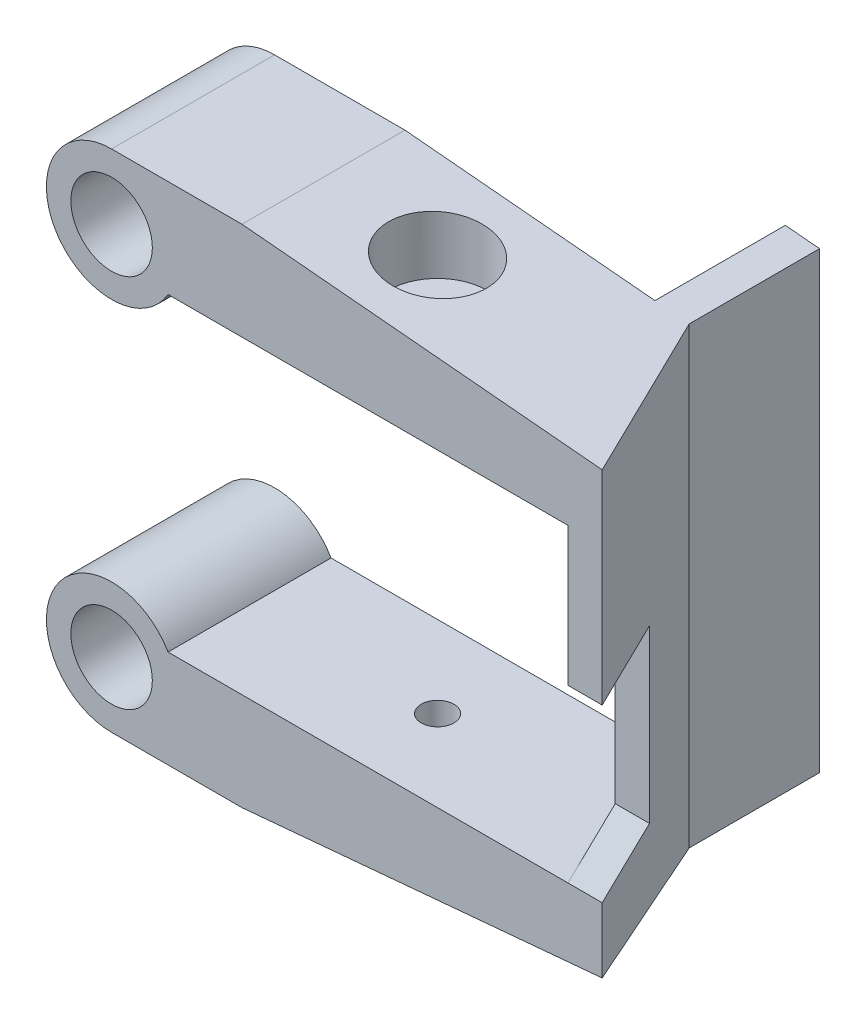
from build123d import *

# Parameters (mm, degrees)
CROQUIS1_R              = 2.5
SALIENTE_EXTRUIR1_DEPTH = 10
CROQUIS2_R              = 1
CORTAR_EXTRUIR1_DEPTH   = 4
CROQUIS3_R              = 3
CORTAR_EXTRUIR2_DEPTH   = 2
SALIENTE_EXTRUIR2_DEPTH = 13.5
SALIENTE_EXTRUIR3_START = 2
CROQUIS6_R              = 3
SALIENTE_EXTRUIR3_DEPTH = 2
CORTAR_EXTRUIR3_DEPTH   = 10
SALIENTE_EXTRUIR4_DEPTH = 8
CORTAR_EXTRUIR4_START   = 25.46614296
CORTAR_EXTRUIR4_DEPTH   = 4.63385704
CORTAR_EXTRUIR5_DEPTH   = 1


# Read off the part's stored shape, not the designer's step: Cortar-Extruir4
with BuildPart() as part:
    # Croquis1 → Saliente-Extruir1 (new body)
    with BuildSketch(Plane.XY):
        with BuildLine():
            Line((3.464101615, 3.5), (28, 3.5))
            Line((28, 3.5), (28, -0.5))
            Line((28, -0.5), (8, -0.5))
            Line((8, -0.5), (8, -2.5))
            Line((8, -2.5), (0, -2.5))
            ThreePointArc((0, -2.5), (-3.464101615, 3.5), (3.464101615, 3.5))
        make_face()
        with Locations((0, 1.5)):
            Circle(CROQUIS1_R, mode=Mode.SUBTRACT)
    extrude(amount=SALIENTE_EXTRUIR1_DEPTH)

    # Croquis2 → Cortar-Extruir1 (cut)
    with BuildSketch(Plane.XZ.offset(0.5)):
        with Locations(Location((15, 5, 0), (0, 0, 270))):
            Circle(CROQUIS2_R)
        Polygon((28, 10), (23.336923418, 0), (28, 0), align=None)
    extrude(amount=-CORTAR_EXTRUIR1_DEPTH, mode=Mode.SUBTRACT)

    # Croquis3 → Cortar-Extruir2 (cut)
    with BuildSketch(Plane.XZ.offset(0.5)):
        with Locations(Location((15, 5, 0), (0, 0, 270))):
            Circle(CROQUIS3_R)
    extrude(amount=-CORTAR_EXTRUIR2_DEPTH, mode=Mode.SUBTRACT)

    # Croquis4 → Saliente-Extruir2 (add)
    with BuildSketch(Plane.XZ.offset(0.5)):
        Polygon((28, 10), (30.1, 10), (25.436923418, 0), (23.336923418, 0), align=None)
    extrude(amount=-SALIENTE_EXTRUIR2_DEPTH)

    # Croquis6 → Saliente-Extruir3 (add)
    with BuildSketch(Plane.XZ.offset(0.5).offset(SALIENTE_EXTRUIR3_START)):
        Polygon((8, 10), (8, 0), (25.436923418, 0), (30.1, 10), align=None)
        with Locations(Location((15, 5, 0), (0, 0, 270))):
            Circle(CROQUIS6_R, mode=Mode.SUBTRACT)
    extrude(amount=-SALIENTE_EXTRUIR3_DEPTH)

    # Croquis7 → Cortar-Extruir3 (cut)
    with BuildSketch(Plane.XY.offset(10)):
        Polygon((30.1, -0.5), (8, -2.5), (30.1, -2.5), align=None)
    extrude(amount=-CORTAR_EXTRUIR3_DEPTH, mode=Mode.SUBTRACT)

    # Croquis8 → Saliente-Extruir4 (add)
    with BuildSketch(Plane(origin=(0, 0, 0), x_dir=(-1, 0, 0), z_dir=(0, 0, -1))):
        Polygon((-23.336923418, 13), (-25.436923418, 13), (-25.436923418, -0.921997881), (-23.336923418, -1.11204313), align=None)
    extrude(amount=SALIENTE_EXTRUIR4_DEPTH)

    # Simetría1: part across plane


with BuildPart() as part_1:
    add(part.part)
    add(part.part.mirror(Plane.ZX.offset(13)))

    # Cortar-Extruir4 outline → Cortar-Extruir4 (cut)
    with BuildSketch(Plane.YZ.offset(CORTAR_EXTRUIR4_START)):
        Polygon((3.729308329, 4.566126042), (14.229308329, 4.566126042), (14, 10), (3.5, 10), align=None)
    extrude(amount=CORTAR_EXTRUIR4_DEPTH, mode=Mode.SUBTRACT)

    # Croquis10 → Cortar-Extruir5 (cut)
    # profile 1 of 3: a face of its own
    with BuildSketch(Plane.XZ.offset(2.5)):
        with BuildLine():
            Line((1.028070301, 6.125289077), (0.713967737, 6.125289077))
            add(Edge.make_bspline(
                [(0.713967737, 6.125289077), (0.717026383, 6.168600373), (0.723004246, 6.253248609), (0.743181793, 6.375949409), (0.769744729, 6.491668594), (0.806730998, 6.599108347), (0.850441665, 6.699676066), (0.904479005, 6.791720758), (0.965336158, 6.877259193), (1.034996488, 6.954351481), (1.111439092, 7.023098089), (1.193874616, 7.083108368), (1.281883279, 7.133628582), (1.375264617, 7.175539337), (1.474317011, 7.207471489), (1.578477625, 7.230811382), (1.688185854, 7.24406359), (1.76304467, 7.24606056), (1.801407641, 7.247083948)],
                knots=[0, 0, 0, 0, 1.189755348, 2.325275364, 3.405357674, 4.440728977, 5.436073419, 6.406440482, 7.361305578, 8.309505056, 9.248656041, 10.17524323, 11.099501498, 12.025889295, 12.976164651, 13.947715552, 14.948263773, 16, 16, 16, 16], degree=3))
            add(Edge.make_bspline(
                [(1.801407641, 7.247083948), (1.833920612, 7.246205758), (1.897998858, 7.244474976), (1.99209662, 7.232907623), (2.081777043, 7.211201368), (2.167610349, 7.183040312), (2.248715847, 7.14503072), (2.326580397, 7.100427059), (2.399321874, 7.045822503), (2.467818389, 6.984561455), (2.529752605, 6.917085875), (2.583881772, 6.845053156), (2.631197417, 6.76986249), (2.667709653, 6.689321523), (2.697901218, 6.605821198), (2.717686318, 6.517936302), (2.730967855, 6.426476454), (2.732445941, 6.363953478), (2.733198506, 6.332120006)],
                knots=[0, 0, 0, 0, 1.070123652, 2.10905505, 3.112767961, 4.102712029, 5.07666027, 6.055516303, 7.050824346, 8.063894789, 9.076439522, 10.059426849, 11.02639504, 11.993363231, 12.96399535, 13.943485777, 14.952929115, 16, 16, 16, 16], degree=3))
            add(Edge.make_bspline(
                [(2.733198506, 6.332120006), (2.731628302, 6.286889361), (2.728470354, 6.19592286), (2.700985294, 6.060359018), (2.657927064, 5.925596484), (2.607398946, 5.812883764), (2.552118779, 5.718085221), (2.496553372, 5.635051979), (2.42680622, 5.541212049), (2.342706113, 5.436735508), (2.245339727, 5.320466334), (2.133871874, 5.193037995), (2.008099336, 5.054892684), (1.918864227, 4.959898543), (1.872220942, 4.910245006)],
                knots=[0, 0, 0, 0, 0.954226203, 1.919110796, 2.908529265, 3.937684395, 4.519156821, 5.224000087, 6.046133778, 6.987113067, 8.055518501, 9.248081135, 10.561569138, 12, 12, 12, 12], degree=3))
            Line((1.872220942, 4.910245006), (1.009140013, 3.971442923))
            Line((1.009140013, 3.971442923), (2.553711327, 3.971442923))
            Line((2.553711327, 3.971442923), (2.513747384, 3.657340359))
            Line((2.513747384, 3.657340359), (0.310121583, 3.657340359))
            Line((0.310121583, 3.657340359), (1.483098346, 4.932680903))
            add(Edge.make_bspline(
                [(1.483098346, 4.932680903), (1.510463436, 4.962576097), (1.563856051, 5.02090525), (1.641582361, 5.106530256), (1.715551847, 5.187572624), (1.783960597, 5.265849417), (1.849241507, 5.339192136), (1.910405141, 5.408694035), (1.967053478, 5.47429508), (2.019142122, 5.536453423), (2.067311726, 5.594390405), (2.111608132, 5.648094897), (2.150945305, 5.698424255), (2.18674182, 5.744090223), (2.217614397, 5.786728032), (2.245096297, 5.824655457), (2.267386719, 5.859435569), (2.303875111, 5.916555433), (2.345560981, 6.000876013), (2.388151293, 6.112877364), (2.413755955, 6.224402399), (2.417339917, 6.298579906), (2.419095942, 6.334924493)],
                knots=[0, 0, 0, 0, 1.413351346, 2.757620165, 4.032814388, 5.239603994, 6.38276682, 7.456908748, 8.468208299, 9.405290065, 10.284970074, 11.095810671, 11.832795857, 12.512582711, 13.11898356, 13.668494667, 14.145465748, 14.559277877, 16.031828034, 17.414029346, 18.732957739, 20, 20, 20, 20], degree=3))
            add(Edge.make_bspline(
                [(2.419095942, 6.334924493), (2.418567396, 6.355517793), (2.417529731, 6.395947423), (2.409019148, 6.455474438), (2.394230593, 6.512306083), (2.373709508, 6.566803729), (2.347540586, 6.618899237), (2.316050095, 6.669045665), (2.277828562, 6.716000599), (2.234439229, 6.759923363), (2.187051829, 6.800237145), (2.136690491, 6.836659643), (2.082076086, 6.865725728), (2.025269742, 6.890682179), (1.965000962, 6.909417922), (1.902018654, 6.923773264), (1.835473713, 6.931217906), (1.790205476, 6.932384646), (1.767052673, 6.932981384)],
                knots=[0, 0, 0, 0, 1.000465277, 1.9641554, 2.914502411, 3.848972691, 4.78860488, 5.743285214, 6.720598248, 7.724474249, 8.739530682, 9.741606237, 10.737743132, 11.739883045, 12.752776938, 13.799858766, 14.874720116, 16, 16, 16, 16], degree=3))
            add(Edge.make_bspline(
                [(1.767052673, 6.932981384), (1.74130985, 6.932302096), (1.691034155, 6.930975448), (1.617361628, 6.920746325), (1.547010259, 6.904951596), (1.479928821, 6.881750078), (1.416865716, 6.851166601), (1.356533596, 6.815464857), (1.30021026, 6.772264466), (1.247906652, 6.722611728), (1.199945726, 6.667128253), (1.157970708, 6.605822817), (1.121041654, 6.539284488), (1.090390132, 6.467122518), (1.065872997, 6.389338869), (1.047149544, 6.306310383), (1.033458691, 6.217765546), (1.029897932, 6.156655192), (1.028070301, 6.125289077)],
                knots=[0, 0, 0, 0, 1.007553214, 1.967749939, 2.906652842, 3.826866328, 4.739542757, 5.646559907, 6.567091782, 7.512083296, 8.465849621, 9.432866967, 10.41581379, 11.440668855, 12.496904277, 13.604523269, 14.770473504, 16, 16, 16, 16], degree=3))
        make_face()
    # profile 2 of 3: a face of its own
    with BuildSketch(Plane.XZ.offset(2.5)):
        with BuildLine():
            Line((4.169095942, 7.157340359), (5.560121583, 7.157340359))
            Line((5.560121583, 7.157340359), (5.515249788, 6.843237794))
            Line((5.515249788, 6.843237794), (4.396960525, 6.843237794))
            Line((4.396960525, 6.843237794), (4.128430878, 5.978754621))
            add(Edge.make_bspline(
                [(4.128430878, 5.978754621), (4.146661529, 5.980367515), (4.181247283, 5.983427368), (4.230492637, 5.988140846), (4.274246638, 5.990128715), (4.301606883, 5.990501655), (4.314228154, 5.990673692)],
                knots=[0, 0, 0, 0, 1.179194268, 2.23707438, 3.186763071, 4, 4, 4, 4], degree=3))
            add(Edge.make_bspline(
                [(4.314228154, 5.990673692), (4.355742272, 5.988924401), (4.438738863, 5.985427152), (4.561197239, 5.956853044), (4.680350502, 5.910400575), (4.795543887, 5.846990147), (4.903088619, 5.766276268), (5.001138387, 5.670891733), (5.086176175, 5.55957644), (5.158580393, 5.435066213), (5.217044003, 5.300421959), (5.260486246, 5.158293999), (5.286130176, 5.009565935), (5.289291099, 4.908239933), (5.290890814, 4.85695975)],
                knots=[0, 0, 0, 0, 0.899783298, 1.798880741, 2.712146335, 3.667462909, 4.641893168, 5.620639862, 6.625573659, 7.670753207, 8.73789667, 9.802833956, 10.8880339, 12, 12, 12, 12], degree=3))
            add(Edge.make_bspline(
                [(5.290890814, 4.85695975), (5.290297699, 4.827964275), (5.28911421, 4.770107386), (5.281268328, 4.684171951), (5.268482381, 4.599465278), (5.251373511, 4.516168727), (5.227681574, 4.434409431), (5.199948562, 4.353986891), (5.166653, 4.274851498), (5.128532949, 4.197783621), (5.085717826, 4.123830552), (5.040375548, 4.053641877), (4.991744029, 3.988003354), (4.939771683, 3.926839288), (4.884471423, 3.870174595), (4.826155971, 3.81782879), (4.764111772, 3.77105426), (4.699727973, 3.728014325), (4.632331314, 3.690314154), (4.563099725, 3.657272547), (4.491597732, 3.6296302), (4.418070572, 3.607687309), (4.342673427, 3.588808932), (4.265028283, 3.576450828), (4.185348404, 3.569525411), (4.131715946, 3.568244537), (4.104592737, 3.567596769)],
                knots=[0, 0, 0, 0, 1.069153237, 2.133363272, 3.179058996, 4.226954022, 5.266274036, 6.315550131, 7.362275136, 8.42982956, 9.483766617, 10.51159017, 11.509535653, 12.493806154, 13.468866151, 14.427139673, 15.380284545, 16.331557598, 17.280759563, 18.225176858, 19.15820187, 20.104151322, 21.053079409, 22.022142036, 22.999750219, 24, 24, 24, 24], degree=3))
            add(Edge.make_bspline(
                [(4.104592737, 3.567596769), (4.076063853, 3.56814877), (4.019581509, 3.569241639), (3.936066756, 3.577542508), (3.855392464, 3.592687139), (3.776894491, 3.611964362), (3.701274292, 3.638127854), (3.628082504, 3.669654716), (3.557680673, 3.707200147), (3.489379938, 3.749834488), (3.424048743, 3.799223338), (3.361312554, 3.854867889), (3.301733914, 3.917246137), (3.245784522, 3.986880129), (3.190805507, 4.061388817), (3.139685017, 4.143390737), (3.091234273, 4.231652148), (3.062149531, 4.293787722), (3.04730107, 4.325509429)],
                knots=[0, 0, 0, 0, 0.988269415, 1.95660558, 2.903067029, 3.829898417, 4.754180254, 5.671628646, 6.587933176, 7.515648187, 8.458049413, 9.421533432, 10.417927647, 11.442155288, 12.514193677, 13.623848283, 14.786917344, 16, 16, 16, 16], degree=3))
            Line((3.04730107, 4.325509429), (3.369115974, 4.465032666))
            add(Edge.make_bspline(
                [(3.369115974, 4.465032666), (3.379344889, 4.441526326), (3.39946189, 4.39529688), (3.433944184, 4.329654011), (3.470435636, 4.268153718), (3.509768778, 4.211207542), (3.551703109, 4.158728031), (3.596128216, 4.110576886), (3.643217597, 4.067230964), (3.707761992, 4.015095441), (3.794323987, 3.962717855), (3.903011114, 3.91532884), (4.016915576, 3.886896817), (4.09438881, 3.883438176), (4.133338731, 3.881699333)],
                knots=[0, 0, 0, 0, 0.90275949, 1.775438862, 2.609846295, 3.420523979, 4.211225742, 4.974361715, 5.725863837, 6.463852149, 7.894145469, 9.273469166, 10.629227771, 12, 12, 12, 12], degree=3))
            add(Edge.make_bspline(
                [(4.133338731, 3.881699333), (4.159788683, 3.882559991), (4.212255398, 3.884267212), (4.289911149, 3.896368054), (4.365429686, 3.917084533), (4.439519257, 3.945224768), (4.511832009, 3.98161038), (4.581513497, 4.02726926), (4.649645957, 4.080115593), (4.715856112, 4.13977805), (4.777637465, 4.206409876), (4.830811735, 4.280372898), (4.876157205, 4.359787883), (4.913511277, 4.444499228), (4.941153871, 4.53553386), (4.962589688, 4.63128437), (4.974290177, 4.733273654), (4.975940579, 4.802945892), (4.97678825, 4.838730583)],
                knots=[0, 0, 0, 0, 0.894042656, 1.773442886, 2.649322443, 3.537059077, 4.448663481, 5.380047919, 6.348784549, 7.361222111, 8.390141551, 9.414226573, 10.433393002, 11.477070126, 12.53659607, 13.644646659, 14.790255748, 16, 16, 16, 16], degree=3))
            add(Edge.make_bspline(
                [(4.97678825, 4.838730583), (4.976085205, 4.868905928), (4.974702581, 4.928249413), (4.964732961, 5.015001865), (4.948815654, 5.097662075), (4.925841501, 5.175749391), (4.895122377, 5.249204315), (4.858949676, 5.318693812), (4.815791134, 5.383851299), (4.766119921, 5.443700119), (4.711690597, 5.498173143), (4.653422193, 5.546556741), (4.590603194, 5.586184536), (4.524974353, 5.619970589), (4.455074957, 5.644931055), (4.381585618, 5.663209335), (4.304545775, 5.674791583), (4.251869152, 5.675972787), (4.225185686, 5.676571128)],
                knots=[0, 0, 0, 0, 1.147206095, 2.25612032, 3.315727791, 4.344786485, 5.344851775, 6.338579953, 7.319511098, 8.310533734, 9.290780363, 10.244278852, 11.183466438, 12.109444453, 13.045558043, 13.998186533, 14.985976718, 16, 16, 16, 16], degree=3))
            add(Edge.make_bspline(
                [(4.225185686, 5.676571128), (4.18139131, 5.674968691), (4.091628727, 5.671684275), (3.954755873, 5.647760899), (3.812796768, 5.610343042), (3.718896129, 5.573980253), (3.670598346, 5.555277057)],
                knots=[0, 0, 0, 0, 0.919956117, 1.88557634, 2.91244643, 4, 4, 4, 4], degree=3))
            Line((3.670598346, 5.555277057), (4.169095942, 7.157340359))
        make_face()
    # profile 3 of 3: a face of its own
    with BuildSketch(Plane.XZ.offset(2.5)):
        with BuildLine():
            add(Edge.make_bspline(
                [(6.763246583, 7.247083948), (6.786648468, 7.246356212), (6.832956778, 7.244916146), (6.900945916, 7.235121899), (6.966109478, 7.218231936), (7.028032324, 7.194106369), (7.087563719, 7.16371415), (7.144194503, 7.126566818), (7.198035088, 7.08265066), (7.24785361, 7.032261021), (7.294562788, 6.977329064), (7.334083441, 6.916588307), (7.36911502, 6.852434482), (7.397035127, 6.783752401), (7.41793264, 6.710773554), (7.4332488, 6.633868074), (7.44356601, 6.552784497), (7.444342055, 6.497149955), (7.444736968, 6.468838756)],
                knots=[0, 0, 0, 0, 0.970717871, 1.920883944, 2.842680434, 3.757311267, 4.672198984, 5.610669493, 6.561577208, 7.54876171, 8.546788736, 9.547073532, 10.549095219, 11.575307918, 12.615394826, 13.693467145, 14.826256018, 16, 16, 16, 16], degree=3))
            add(Edge.make_bspline(
                [(7.444736968, 6.468838756), (7.444228315, 6.435843674), (7.443232692, 6.371260082), (7.430588025, 6.276801088), (7.411810671, 6.186744712), (7.386106095, 6.100546957), (7.351632943, 6.019043911), (7.309081675, 5.942319211), (7.260083813, 5.869606124), (7.203321825, 5.802733053), (7.141239532, 5.742074494), (7.075320108, 5.688358328), (7.005208301, 5.643083667), (6.931653419, 5.605944933), (6.85439339, 5.576713595), (6.773667676, 5.556643879), (6.689301685, 5.5444055), (6.631944973, 5.542783208), (6.602689692, 5.541955743)],
                knots=[0, 0, 0, 0, 1.130854088, 2.213500164, 3.262022406, 4.283858738, 5.293169922, 6.29044296, 7.288617459, 8.29537939, 9.292942272, 10.261820963, 11.206697579, 12.149430033, 13.082848615, 14.033453143, 14.996945993, 16, 16, 16, 16], degree=3))
            add(Edge.make_bspline(
                [(6.602689692, 5.541955743), (6.578813311, 5.54263742), (6.532023196, 5.543973291), (6.46326104, 5.554276596), (6.39728756, 5.569956249), (6.33426096, 5.593395358), (6.274818091, 5.623730992), (6.217873294, 5.659955521), (6.163805302, 5.702673153), (6.113824042, 5.752320928), (6.068217354, 5.806975994), (6.028015744, 5.866003397), (5.994164078, 5.929473362), (5.967088753, 5.997104228), (5.945095015, 6.068080467), (5.929708845, 6.143202044), (5.920493987, 6.222277402), (5.919567714, 6.276472379), (5.919095942, 6.304075134)],
                knots=[0, 0, 0, 0, 0.998939331, 1.957603429, 2.904214697, 3.832710991, 4.764499105, 5.69253155, 6.653438724, 7.642559757, 8.635735374, 9.628718291, 10.626459594, 11.640042448, 12.673490826, 13.732455774, 14.845087277, 16, 16, 16, 16], degree=3))
            add(Edge.make_bspline(
                [(5.919095942, 6.304075134), (5.919990826, 6.337290984), (5.921741671, 6.402277945), (5.932942527, 6.497844014), (5.95245761, 6.588935053), (5.980174136, 6.675600605), (6.014292732, 6.758395336), (6.057504542, 6.836405501), (6.108196353, 6.910374374), (6.166071737, 6.979312046), (6.229379391, 7.041761753), (6.295975255, 7.097254916), (6.366789862, 7.142721871), (6.439808455, 7.181031804), (6.516210681, 7.210785498), (6.595716637, 7.231666142), (6.67844352, 7.244784409), (6.734684978, 7.246309465), (6.763246583, 7.247083948)],
                knots=[0, 0, 0, 0, 1.130922342, 2.21265473, 3.270805013, 4.297553847, 5.306888354, 6.314716204, 7.327776304, 8.355757729, 9.374178632, 10.352259942, 11.301297143, 12.233743801, 13.155811409, 14.086116658, 15.028055401, 16, 16, 16, 16], degree=3))
        make_face()
        with BuildLine():
            add(Edge.make_bspline(
                [(6.751327513, 6.977853179), (6.727167384, 6.976986136), (6.679045156, 6.975259157), (6.607780016, 6.958789525), (6.538083358, 6.93291757), (6.471121405, 6.896167466), (6.407980947, 6.85123848), (6.351943386, 6.796043677), (6.30239859, 6.732684849), (6.261628861, 6.660360581), (6.228535072, 6.582099105), (6.205457263, 6.498175806), (6.191177838, 6.409732646), (6.18928826, 6.349001706), (6.188326711, 6.31809757)],
                knots=[0, 0, 0, 0, 0.898823508, 1.790279833, 2.710439412, 3.660988812, 4.627551506, 5.588017192, 6.580694835, 7.614151002, 8.671642138, 9.738410943, 10.84914581, 12, 12, 12, 12], degree=3))
            add(Edge.make_bspline(
                [(6.188326711, 6.31809757), (6.189693432, 6.281517339), (6.192317189, 6.211292568), (6.215427151, 6.111410023), (6.255446167, 6.023526536), (6.309351253, 5.947730935), (6.376298302, 5.887375214), (6.452116326, 5.842494771), (6.536881518, 5.815532837), (6.596185756, 5.812657588), (6.626527833, 5.811186512)],
                knots=[0, 0, 0, 0, 1.167761783, 2.24180663, 3.250972385, 4.235329223, 5.192198183, 6.109164403, 7.032583837, 8, 8, 8, 8], degree=3))
            add(Edge.make_bspline(
                [(6.626527833, 5.811186512), (6.646663604, 5.811638425), (6.68598642, 5.812520956), (6.743637475, 5.822017366), (6.798151253, 5.837400039), (6.849951382, 5.858330238), (6.898194026, 5.886376225), (6.943671629, 5.919890516), (6.986213359, 5.959691295), (7.024954131, 6.005188608), (7.060374972, 6.054439612), (7.091532899, 6.10665655), (7.117639686, 6.161578716), (7.138226134, 6.219061206), (7.1555791, 6.278409767), (7.167288483, 6.340385836), (7.174489623, 6.404863261), (7.175164336, 6.448720579), (7.175506198, 6.470942121)],
                knots=[0, 0, 0, 0, 1.007750251, 1.968018882, 2.916659645, 3.840494567, 4.758079246, 5.703899357, 6.664595947, 7.668873183, 8.692139613, 9.699889865, 10.710423493, 11.732484109, 12.755080818, 13.804198226, 14.88743536, 16, 16, 16, 16], degree=3))
            add(Edge.make_bspline(
                [(7.175506198, 6.470942121), (7.174211017, 6.508246309), (7.171739054, 6.579444498), (7.148079722, 6.679803992), (7.110349139, 6.768630187), (7.055762978, 6.842700389), (6.991309548, 6.902874272), (6.918256607, 6.947110674), (6.836962154, 6.973287281), (6.780261668, 6.976310457), (6.751327513, 6.977853179)],
                knots=[0, 0, 0, 0, 1.207628711, 2.304861276, 3.322697533, 4.315405203, 5.264472711, 6.164993415, 7.063599473, 8, 8, 8, 8], degree=3))
        make_face(mode=Mode.SUBTRACT)
    extrude(amount=-CORTAR_EXTRUIR5_DEPTH, mode=Mode.SUBTRACT)


solid = part_1.part
